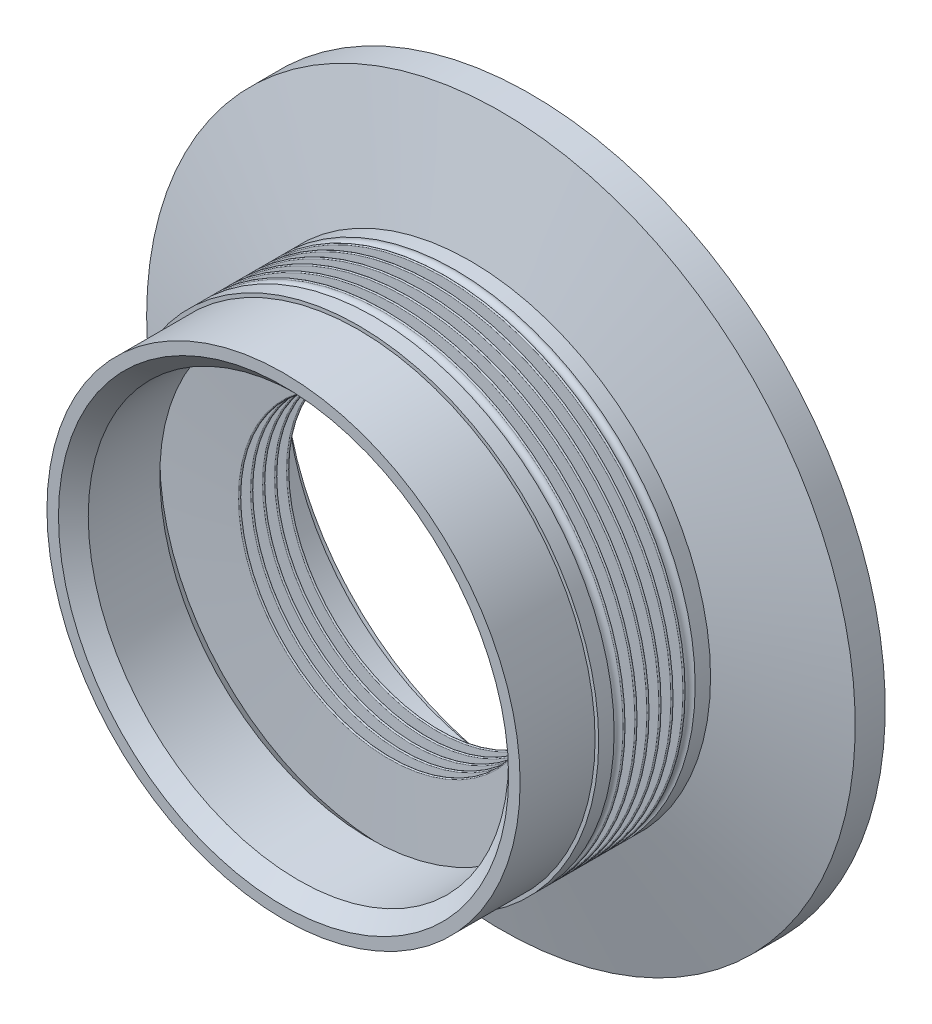
from build123d import *

# Parameters (mm, degrees)
LPATTERN1_COUNT = 5
LPATTERN1_PITCH = 1.27
CHAMFER1_SIZE   = 1.5748


with BuildPart() as part:
    # Sketch2 → Revolve1 (revolve)
    with BuildSketch(Plane(origin=(0, 0, 0), x_dir=(0, 0, -1), z_dir=(1, 0, 0))):
        with BuildLine():
            Line((0, 25.4), (0, 25.2984))
            Line((0, 25.2984), (-0.533565819, 15.970797672))
            ThreePointArc((-0.533565819, 15.970797672), (-0.635, 15.875), (-0.736434181, 15.970797672))
            Line((-0.736434181, 15.970797672), (-1.27, 25.2984))
            Line((-1.27, 25.2984), (-1.27, 25.4))
            ThreePointArc((-1.27, 25.4), (-1.20023954, 25.372265), (-1.168565819, 25.304202328))
            Line((-1.168565819, 25.304202328), (-0.635, 15.9766))
            Line((-0.635, 15.9766), (-0.101434181, 25.304202328))
            ThreePointArc((-0.101434181, 25.304202328), (-0.06976046, 25.372265), (0, 25.4))
        make_face()
    revolve1 = revolve(axis=Axis((0, 0, 7.794513673), (0, 0, 1)))

    # LPattern1: Revolve1 ×5
    with Locations(*[(0, 0, i * LPATTERN1_PITCH) for i in range(1, LPATTERN1_COUNT)]):
        add(revolve1)

    # Sketch8 → Revolve4 (revolve)
    with BuildSketch(Plane(origin=(0, 0, 0), x_dir=(0, 0, -1), z_dir=(1, 0, 0))):
        with BuildLine():
            Line((1.109073706, 25.4), (2.736192993, 25.4))
            Line((2.736192993, 25.4), (5.969, 37.465))
            Line((5.969, 37.465), (9.144, 37.465))
            Line((9.144, 37.465), (9.144, 26.1112))
            Line((9.144, 26.1112), (7.112, 26.1112))
            Line((7.112, 26.1112), (7.112, 23.749))
            Line((7.112, 23.749), (0.762, 23.749))
            Line((0.762, 23.749), (0, 24.511))
            Line((0, 24.511), (0, 25.4))
            ThreePointArc((0, 25.4), (0.065582518, 25.375998282), (0.100178951, 25.315333333))
            ThreePointArc((0.100178951, 25.315333333), (0.643555846, 24.893779428), (1.109073706, 25.4))
        make_face()
    revolve(axis=Axis((0, 0, 7.794513673), (0, 0, 1)))

    # Sketch9 → Revolve5 (revolve)
    with BuildSketch(Plane(origin=(0, 0, 0), x_dir=(0, 0, -1), z_dir=(1, 0, 0))):
        with BuildLine():
            Line((-6.35, 23.749), (-7.874, 22.225))
            Line((-7.874, 22.225), (-17.018, 22.225))
            Line((-17.018, 22.225), (-17.018, 25.019))
            Line((-17.018, 25.019), (-9.0932, 25.019))
            Line((-9.0932, 25.019), (-9.0932, 25.4))
            Line((-9.0932, 25.4), (-7.459073706, 25.4))
            ThreePointArc((-7.459073706, 25.4), (-6.993555846, 24.893779428), (-6.450178951, 25.315333333))
            ThreePointArc((-6.450178951, 25.315333333), (-6.415582518, 25.375998282), (-6.35, 25.4))
            Line((-6.35, 25.4), (-6.35, 23.749))
        make_face()
    revolve(axis=Axis((0, 0, 34.413158008), (0, 0, -1)))

    # Chamfer1
    chamfer1_edges = [part.edges().sort_by_distance(p)[0] for p in [
        (0, -22.225, 17.018),
    ]]
    chamfer(chamfer1_edges, length=CHAMFER1_SIZE)


solid = part.part
